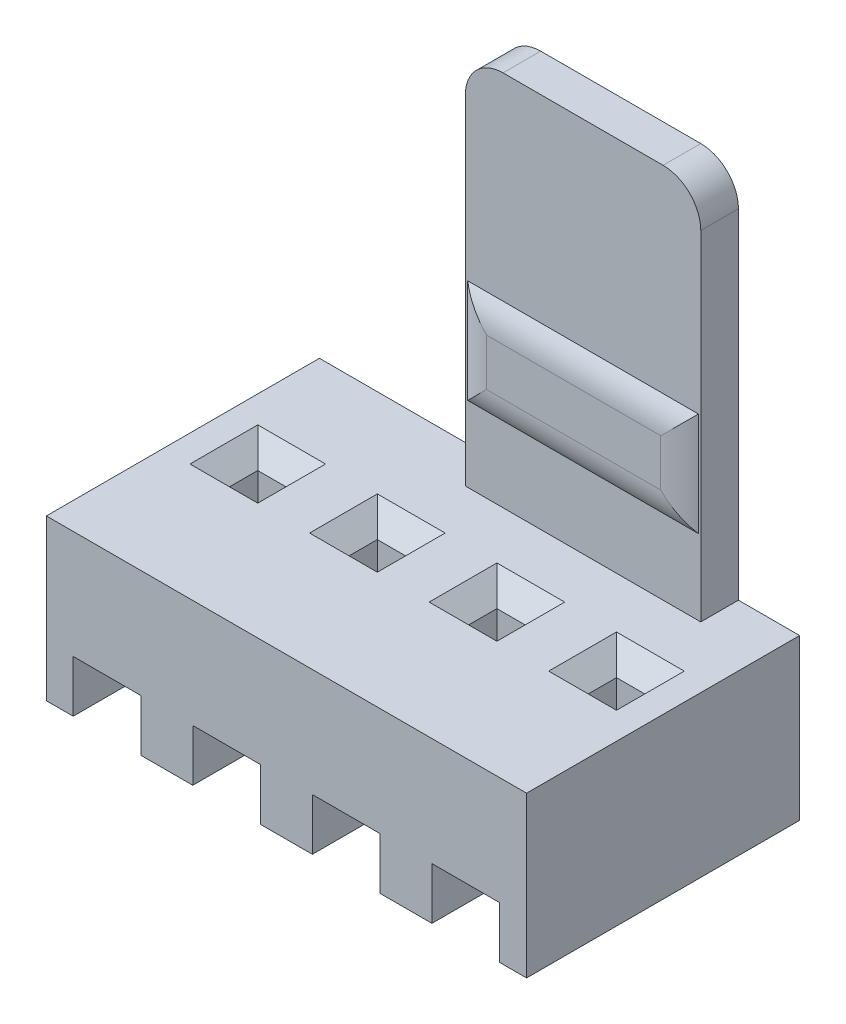
from build123d import *

# Parameters (mm, degrees)
AUFSATZ_LINEAR_AUSTRAGEN1_DEPTH = 5.8
SKIZZE1_3_W                     = 4.5
SKIZZE1_3_H                     = 1.8
AUFSATZ_LINEAR_AUSTRAGEN2_DEPTH = 0.8
SKIZZE1_4_W                     = 4.5
SKIZZE1_4_H                     = 1.8
AUFSATZ_LINEAR_AUSTRAGEN3_DEPTH = 1
FASE1_SIZE                      = 0.2
VERRUNDUNG1_START               = -2
VERRUNDUNG1_DEPTH               = 7
VERRUNDUNG1_START_2             = 4
VERRUNDUNG1_2_DEPTH             = 4
SKIZZE3_W                       = 0.6
SKIZZE3_H                       = 0.6
SCHNITT_LINEAR_AUSTRAGEN1_DEPTH = 12.119802157
FASE2_SIZE                      = 0.42


with BuildPart() as part:
    # Skizze1 → Aufsatz-Linear austragen1 (new body)
    with BuildSketch(Plane.XY):
        Polygon((-1.99, 1.1), (-0.55, 1.1), (-0.55, 0), (0.55, 0), (0.55, 1.1), (1.99, 1.1), (1.99, 0), (3.09, 0), (3.09, 1.1), (4.53, 1.1), (4.53, 0), (5.1, 0), (5.1, 3.4), (3.8, 3.4), (-1.2, 3.4), (-5.1, 3.4), (-5.1, 0), (-4.53, 0), (-4.53, 1.1), (-3.09, 1.1), (-3.09, 0), (-1.99, 0), align=None)
    extrude(amount=AUFSATZ_LINEAR_AUSTRAGEN1_DEPTH)

    # Skizze1<3> → Aufsatz-Linear austragen2 (add)
    # profile 1 of 2: a face of its own
    with BuildSketch(Plane.XY):
        with BuildLine():
            Line((-1.2, 10.6), (-1.2, 3.4))
            Line((-1.2, 3.4), (3.8, 3.4))
            Line((3.8, 3.4), (3.8, 10.6))
            ThreePointArc((3.8, 10.6), (3.565685425, 11.165685425), (3, 11.4))
            Line((3, 11.4), (-0.4, 11.4))
            ThreePointArc((-0.4, 11.4), (-0.965685425, 11.165685425), (-1.2, 10.6))
        make_face()
        with Locations((1.3, 6.1)):
            Rectangle(SKIZZE1_3_W, SKIZZE1_3_H, mode=Mode.SUBTRACT)
    # profile 2 of 2: a face of its own
    with BuildSketch(Plane.XY):
        with Locations((1.3, 6.1)):
            Rectangle(SKIZZE1_3_W, SKIZZE1_3_H)
    extrude(amount=AUFSATZ_LINEAR_AUSTRAGEN2_DEPTH)

    # Skizze1<4> → Aufsatz-Linear austragen3 (add)
    with BuildSketch(Plane.XY):
        with Locations((1.3, 6.1)):
            Rectangle(SKIZZE1_4_W, SKIZZE1_4_H)
    extrude(amount=AUFSATZ_LINEAR_AUSTRAGEN3_DEPTH)

    # Fase1
    fase1_edges = [part.edges().sort_by_distance(p)[0] for p in [
        (-0.95, 6.1, 0.8),
        (1.3, 5.2, 0.8),
        (3.55, 6.1, 0.8),
        (1.3, 7, 0.8),
    ]]
    chamfer(fase1_edges, length=FASE1_SIZE - 0.0001)  # a hair under: the kernel refuses the full size

    # Verrundung1: read off the stored shape, not the designer's step
    # Verrundung1 outline → Verrundung1 (cut)
    with BuildSketch(Plane.YZ.offset(VERRUNDUNG1_START)):
        with BuildLine():
            ThreePointArc((5, 0.8), (5.283772234, 0.948683298), (5.6, 1))
            Line((5.6, 1), (5.2, 1))
            Line((5.2, 1), (5, 0.8))
        make_face()
        with BuildLine():
            ThreePointArc((6.6, 1), (6.916227766, 0.948683298), (7.2, 0.8))
            Line((7.2, 0.8), (7, 1))
            Line((7, 1), (6.6, 1))
        make_face()
    extrude(amount=VERRUNDUNG1_DEPTH, mode=Mode.SUBTRACT)

    # Verrundung1 2 outline → Verrundung1 2 (cut)
    with BuildSketch(Plane(origin=(0, 0, 0), x_dir=(1, 0, 0), z_dir=(0, 1, 0)).offset(VERRUNDUNG1_START_2)):
        with BuildLine():
            Line((-0.95, -1), (-0.55, -1))
            ThreePointArc((-0.55, -1), (-0.866227766, -0.948683298), (-1.15, -0.8))
            Line((-1.15, -0.8), (-0.95, -1))
        make_face()
        with BuildLine():
            ThreePointArc((3.75, -0.8), (3.466227766, -0.948683298), (3.15, -1))
            Line((3.15, -1), (3.55, -1))
            Line((3.55, -1), (3.75, -0.8))
        make_face()
    extrude(amount=VERRUNDUNG1_2_DEPTH, mode=Mode.SUBTRACT)

    # Skizze3 → Schnitt-Linear austragen1 (cut, through all)
    with BuildSketch(Plane(origin=(0, 3.4, 0), x_dir=(1, 0, 0), z_dir=(0, 1, 0))):
        with Locations((1.27, -2.6)):
            Rectangle(SKIZZE3_W, SKIZZE3_H)
        with Locations((-1.27, -2.6)):
            Rectangle(SKIZZE3_W, SKIZZE3_H)
        with Locations((-3.81, -2.6)):
            Rectangle(SKIZZE3_W, SKIZZE3_H)
        with Locations((3.81, -2.6)):
            Rectangle(SKIZZE3_W, SKIZZE3_H)
    extrude(amount=-SCHNITT_LINEAR_AUSTRAGEN1_DEPTH, mode=Mode.SUBTRACT)

    # Fase2
    fase2_edges = [part.edges().sort_by_distance(p)[0] for p in [
        (3.81, 3.4, 2.3),
        (3.51, 3.4, 2.6),
        (3.81, 3.4, 2.9),
        (4.11, 3.4, 2.6),
        (1.27, 3.4, 2.3),
        (0.97, 3.4, 2.6),
        (1.27, 3.4, 2.9),
        (1.57, 3.4, 2.6),
        (-3.51, 3.4, 2.6),
        (-3.81, 3.4, 2.3),
        (-4.11, 3.4, 2.6),
        (-3.81, 3.4, 2.9),
        (-0.97, 3.4, 2.6),
        (-1.27, 3.4, 2.3),
        (-1.57, 3.4, 2.6),
        (-1.27, 3.4, 2.9),
    ]]
    chamfer(fase2_edges, length=FASE2_SIZE)


solid = part.part
